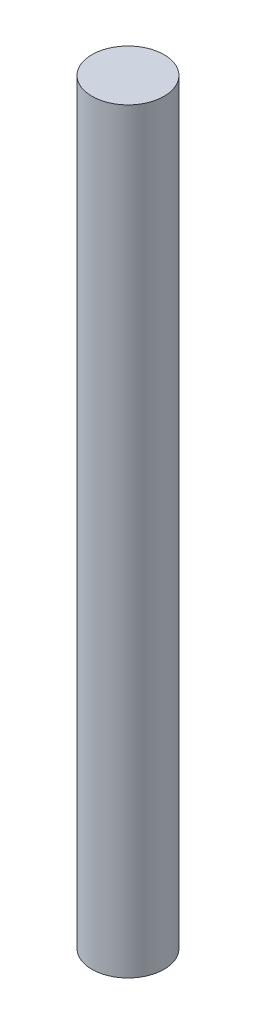
from build123d import *

# Parameters (mm, degrees)
SKETCH_1_R      = 16.7
EXTRUDE_1_DEPTH = 350


with BuildPart() as part:
    # Эскиз1 → Бобышка-Вытянуть1 (new body)
    with BuildSketch(Plane(origin=(0, 0, 0), x_dir=(1, 0, 0), z_dir=(0, 1, 0))):
        Circle(SKETCH_1_R)
    extrude(amount=EXTRUDE_1_DEPTH)


solid = part.part
